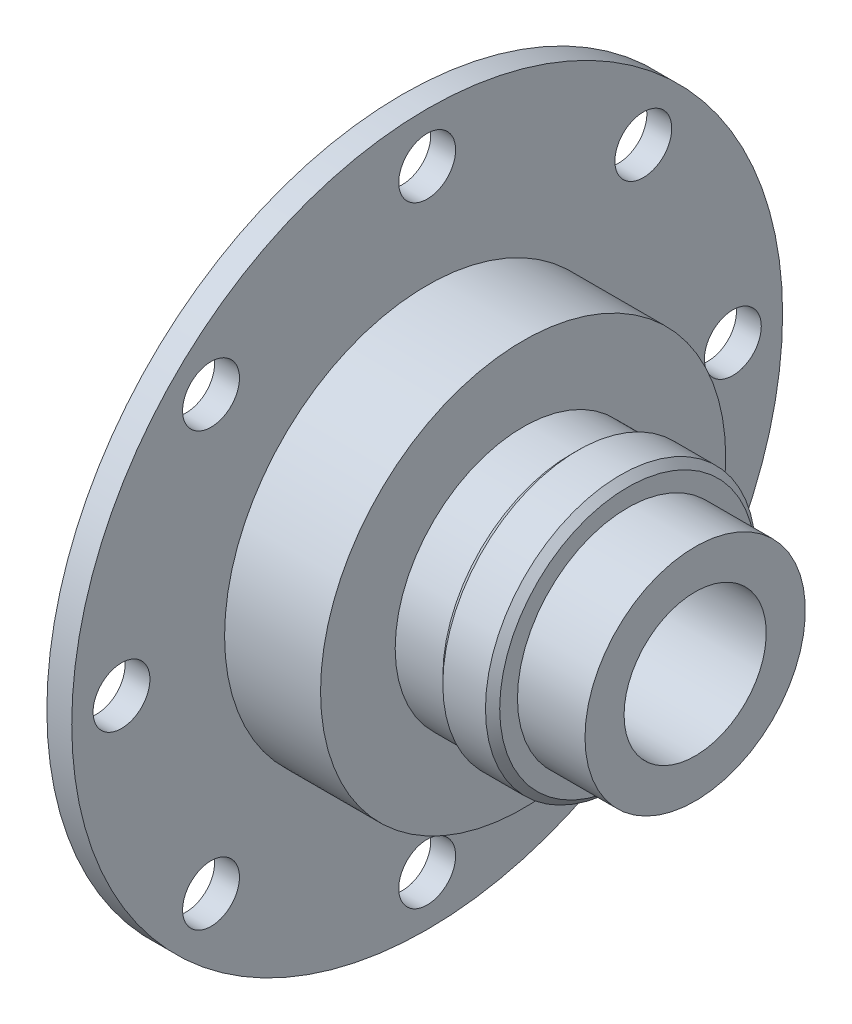
from build123d import *

# Parameters (mm, degrees)
CROQUIS2_R            = 4
CORTAR_EXTRUIR1_DEPTH = 81.132952023
CHAFL_N1_SIZE         = 1


with BuildPart() as part:
    # Croquis1 → Revolución1 (revolve)
    with BuildSketch(Plane.XY, mode=Mode.PRIVATE) as revoluci_n1_sk:
        Polygon((0, 22.25), (9.5, 22.25), (9.5, 10), (41.2, 10), (41.2, 15.5), (31.7, 15.5), (31.7, 18), (31.7, 19), (23.7, 19), (23.7, 18), (17, 18), (17, 28.5), (3.5, 28.5), (3.5, 50), (0, 50), align=None)
    revolve(revoluci_n1_sk.sketch.rotate(Axis((-60.102579917, 0, 0), (1, 0, 0)), 90), axis=Axis((-60.102579917, 0, 0), (1, 0, 0)))

    # Croquis2 → Cortar-Extruir1 (cut, through all)
    with BuildSketch(Plane(origin=(3.5, 0, 0), x_dir=(0, 0, -1), z_dir=(1, 0, 0))):
        with Locations((0, 43)):
            Circle(CROQUIS2_R)
        with Locations((30.405591591, 30.405591591)):
            Circle(CROQUIS2_R)
        with Locations((43, 0)):
            Circle(CROQUIS2_R)
        with Locations((30.405591591, -30.405591591)):
            Circle(CROQUIS2_R)
        with Locations((0, -43)):
            Circle(CROQUIS2_R)
        with Locations((-30.405591591, -30.405591591)):
            Circle(CROQUIS2_R)
        with Locations((-43, 0)):
            Circle(CROQUIS2_R)
        with Locations((-30.405591591, 30.405591591)):
            Circle(CROQUIS2_R)
    extrude(amount=-CORTAR_EXTRUIR1_DEPTH, mode=Mode.SUBTRACT)

    # Chaflán1
    chafl_n1_edges = [part.edges().sort_by_distance(p)[0] for p in [
        (23.7, 0, -19),
        (31.7, 0, -19),
    ]]
    chamfer(chafl_n1_edges, length=CHAFL_N1_SIZE - 0.0001)  # a hair under: the kernel refuses the full size


solid = part.part
